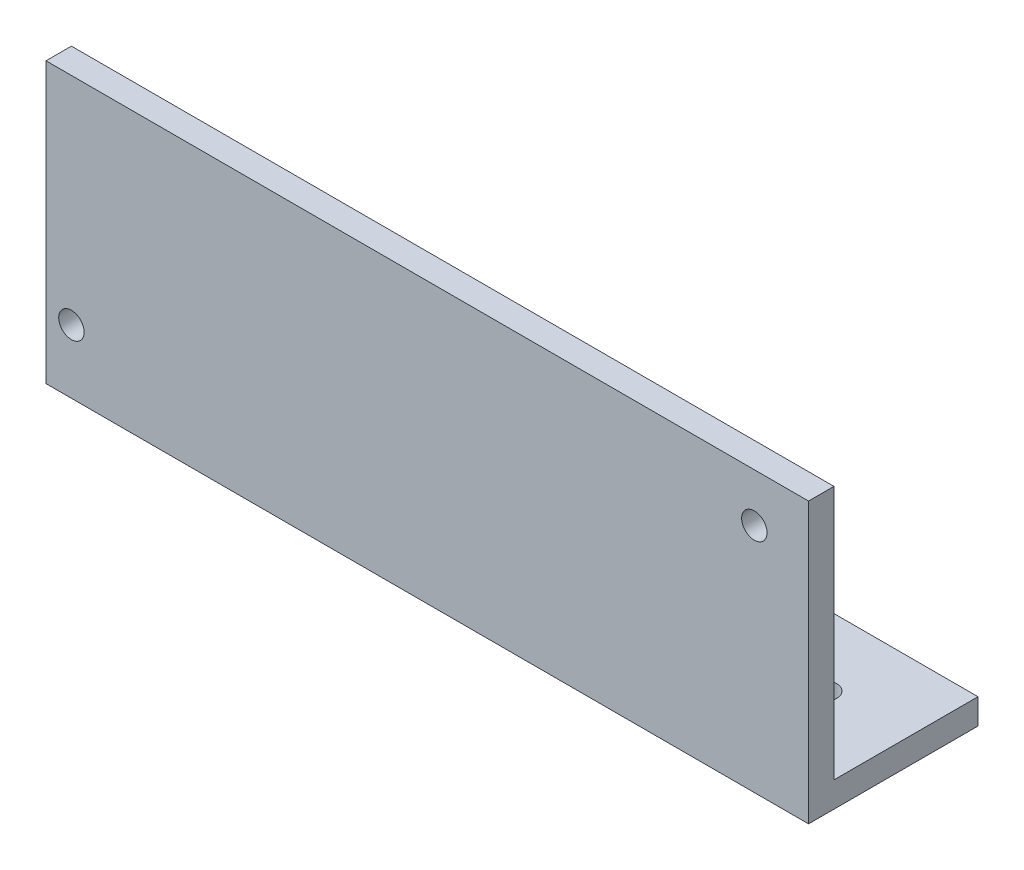
from build123d import *

# Parameters (mm, degrees)
SKETCH1_W           = 90
SKETCH1_H           = 20
SKETCH1_R           = 1.5
BOSS_EXTRUDE1_DEPTH = 3
SKETCH2_W           = 90
SKETCH2_H           = 30
SKETCH2_R           = 1.5
BOSS_EXTRUDE2_DEPTH = 3


with BuildPart() as part:
    # Sketch1 → Boss-Extrude1 (new body)
    with BuildSketch(Plane(origin=(0, 0, 0), x_dir=(1, 0, 0), z_dir=(0, 1, 0))):
        with Locations((31.143497758, 2.511210762)):
            Rectangle(SKETCH1_W, SKETCH1_H)
        with Locations((-6.338089317, 4.011210762)):
            Circle(SKETCH1_R, mode=Mode.SUBTRACT)
        with Locations((66.470970633, 4.011210762)):
            Circle(SKETCH1_R, mode=Mode.SUBTRACT)
    extrude(amount=BOSS_EXTRUDE1_DEPTH)

    # Sketch2 → Boss-Extrude2 (add)
    with BuildSketch(Plane.XY.offset(7.488789238)):
        with Locations((31.143497758, 18)):
            Rectangle(SKETCH2_W, SKETCH2_H)
        with Locations((-10.856502242, 7.5)):
            Circle(SKETCH2_R, mode=Mode.SUBTRACT)
        with Locations((69.743497758, 27.3)):
            Circle(SKETCH2_R, mode=Mode.SUBTRACT)
    extrude(amount=-BOSS_EXTRUDE2_DEPTH)


solid = part.part
